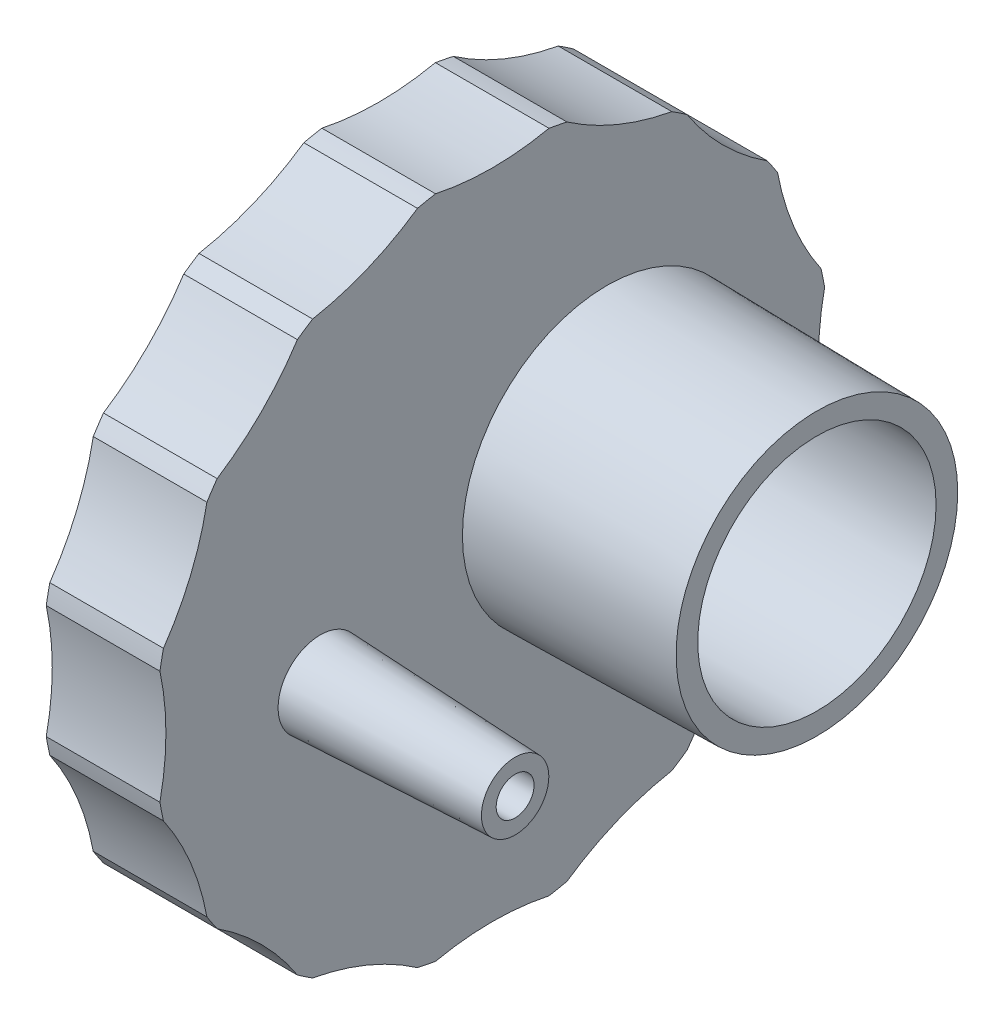
from build123d import *

# Parameters (mm, degrees)
THREAD1_PITCH       = 3
SKETCH7_R           = 25
CUT_EXTRUDE1_DEPTH  = 46.791866117
CIRPATTERN1_COUNT   = 16
SKETCH8_R           = 13.35
BOSS_EXTRUDE1_DEPTH = 19.4
BOSS_EXTRUDE1_TAPER = 1
SKETCH10_R          = 1.75
CUT_EXTRUDE3_DEPTH  = 19.4
SKETCH11_R          = 3.9
BOSS_EXTRUDE2_DEPTH = 18
BOSS_EXTRUDE2_TAPER = 2.5
CUT_EXTRUDE4_START  = -18
SKETCH12_R          = 1.75
CUT_EXTRUDE4_DEPTH  = 18
BOSS_EXTRUDE3_DEPTH = 1


# Read off the part's stored shape, not the designer's step: Cut-Extrude2
with BuildPart() as part:
    # Sketch1 → Revolve1 (revolve)
    with BuildSketch(Plane.XY, mode=Mode.PRIVATE) as revolve1_sk:
        Polygon((10, 19.375), (0, 19.375), (0, 22.5), (10.5, 22.5), (10.5, 28), (2, 28), (2, 31.15), (12.5, 31.15), (12.5, 0), (10, 0), align=None)
    revolve(revolve1_sk.sketch.rotate(Axis((0, 0, 0), (1, 0, 0)), 90), axis=Axis((0, 0, 0), (1, 0, 0)))

    # Thread1: the profile of Thread Profile1 profile screwed along a right-hand helix of 3.666667 turns, 10 arcs to a turn; built about Z, then put on its axis
    thread1_z = Axis((0, 0, 0), (0, 0, 1))
    thread1_corners = [(22.5003, 0, -0.000173205), (22.5003, 0, 2.625173197), (20.876202375, 0, 1.687499996), (20.876202375, 0, 0.937499996)]
    with BuildLine(mode=Mode.PRIVATE) as thread1_profile:
        Line(thread1_corners[0], thread1_corners[1])
        Line(thread1_corners[1], thread1_corners[2])
        Line(thread1_corners[2], thread1_corners[3])
        Line(thread1_corners[3], thread1_corners[0])
    thread1_cap = Face(thread1_profile.wire())
    thread1_turn_angles = [0, 18, 36, 54, 72, 90, 108, 126, 144, 162, 180, 198, 216, 234, 252, 270, 288, 306, 324, 342, 360]
    thread1_turn_weights = [1, 0.9510565162951535, 1, 0.9510565162951535, 1, 0.9510565162951535, 1, 0.9510565162951535, 1, 0.9510565162951535, 1, 0.9510565162951535, 1, 0.9510565162951535, 1, 0.9510565162951535, 1, 0.9510565162951535, 1, 0.9510565162951535, 1]
    thread1_turn_rails = [Edge.make_bspline([Vector(p[0], p[1], 0).rotate(thread1_z, thread1_turn_angles[k]) / thread1_turn_weights[k] + Vector(0, 0, p[2] + THREAD1_PITCH * thread1_turn_angles[k] / 360) for k in range(21)], [0, 0, 0, 1, 1, 2, 2, 3, 3, 4, 4, 5, 5, 6, 6, 7, 7, 8, 8, 9, 9, 10, 10, 10], 2, thread1_turn_weights) for p in thread1_corners]
    thread1_turn_sides = [Face.make_surface_from_curves(thread1_turn_rails[p[0]], thread1_turn_rails[p[1]]) for p in [(0, 1), (1, 2), (2, 3), (3, 0)]]
    thread1_last_angles = [1080, 1098, 1116, 1134, 1152, 1170, 1188, 1206, 1224, 1242, 1260, 1278, 1296, 1308, 1320]
    thread1_last_weights = [1, 0.9510565162951535, 1, 0.9510565162951535, 1, 0.9510565162951535, 1, 0.9510565162951535, 1, 0.9510565162951535, 1, 0.9510565162951535, 1, 0.9781476007338065, 1]
    thread1_last_rails = [Edge.make_bspline([Vector(p[0], p[1], 0).rotate(thread1_z, thread1_last_angles[k]) / thread1_last_weights[k] + Vector(0, 0, p[2] + THREAD1_PITCH * thread1_last_angles[k] / 360) for k in range(15)], [0, 0, 0, 1, 1, 2, 2, 3, 3, 4, 4, 5, 5, 6, 6, 7, 7, 7], 2, thread1_last_weights) for p in thread1_corners]
    thread1_last_sides = [Face.make_surface_from_curves(thread1_last_rails[p[0]], thread1_last_rails[p[1]]) for p in [(0, 1), (1, 2), (2, 3), (3, 0)]]
    thread1 = Plane(origin=(-3, 0, 0), x_dir=(0, 0, -1), z_dir=(1, 0, 0)) * Solid(Shell([*[p.moved(Location((0, 0, THREAD1_PITCH * i))) for i in range(3) for p in thread1_turn_sides], *thread1_last_sides, thread1_cap, thread1_cap.rotate(thread1_z, 1320).moved(Location((0, 0, THREAD1_PITCH * 1320 / 360)))]))
    add(thread1, mode=Mode.SUBTRACT)

    # Sketch7 → Cut-Extrude1 (cut, through all)
    with BuildSketch(Plane(origin=(12.5, 0, 0), x_dir=(0, 0, -1), z_dir=(1, 0, 0))):
        with Locations((55.15, 0)):
            Circle(SKETCH7_R)
    cut_extrude1 = extrude(amount=-CUT_EXTRUDE1_DEPTH, mode=Mode.SUBTRACT)

    # CirPattern1: Cut-Extrude1 ×16 about axis
    cirpattern1_axis = Axis((0, 0, 0), (1, 0, 0))
    for i in range(1, CIRPATTERN1_COUNT):
        add(cut_extrude1.rotate(cirpattern1_axis, i * 360 / CIRPATTERN1_COUNT), mode=Mode.SUBTRACT)

    # Sketch8 → Boss-Extrude1 (add)
    with BuildSketch(Plane(origin=(12.5, 0, 0), x_dir=(0, 0, -1), z_dir=(1, 0, 0))):
        with Locations((10.592481028, 2.106975478)):
            Circle(SKETCH8_R)
    extrude(amount=BOSS_EXTRUDE1_DEPTH, taper=BOSS_EXTRUDE1_TAPER)

    # Cut-Extrude2 outline → Cut-Extrude2 (revolve, cut)
    with BuildSketch(Plane(origin=(0, 2.106975478, -10.592481028), x_dir=(0, 1, 0), z_dir=(0, 0, -1))):
        Polygon((11.01137174, 31.9), (0, 31.9), (0, 10), (11.393637662, 10), align=None)
    revolve(axis=Axis((0, 2.106975478, -10.592481028), (1, 0, 0)), mode=Mode.SUBTRACT)

    # Sketch10 → Cut-Extrude3 (cut)
    with BuildSketch(Plane(origin=(12.5, 0, 0), x_dir=(0, 0, -1), z_dir=(1, 0, 0))):
        with Locations((-15.888721543, -3.160463217)):
            Circle(SKETCH10_R)
    extrude(amount=-CUT_EXTRUDE3_DEPTH, mode=Mode.SUBTRACT)

    # Sketch11 → Boss-Extrude2 (add)
    with BuildSketch(Plane(origin=(12.5, 0, 0), x_dir=(0, 0, -1), z_dir=(1, 0, 0))):
        with Locations((-15.888721543, -3.160463217)):
            Circle(SKETCH11_R)
    extrude(amount=BOSS_EXTRUDE2_DEPTH, taper=BOSS_EXTRUDE2_TAPER)

    # Sketch12 → Cut-Extrude4 (cut)
    with BuildSketch(Plane.ZY.offset(-12.5).offset(CUT_EXTRUDE4_START)):
        with Locations(Location((15.888721543, -3.160463217, 0), (0, 0, 180))):
            Circle(SKETCH12_R)
    extrude(amount=CUT_EXTRUDE4_DEPTH, mode=Mode.SUBTRACT)

    # Sketch13 → Boss-Extrude3 (add)
    with BuildSketch(Plane.ZY.offset(-2)):
        with BuildLine():
            ThreePointArc((20.782874345, 1.971790954), (13.437628867, -2.451972388), (18.747114795, -9.184852337))
            ThreePointArc((18.747114795, -9.184852337), (20.537105023, -3.74741816), (20.782874345, 1.971790954))
        make_face()
    extrude(amount=-BOSS_EXTRUDE3_DEPTH)


solid = part.part
